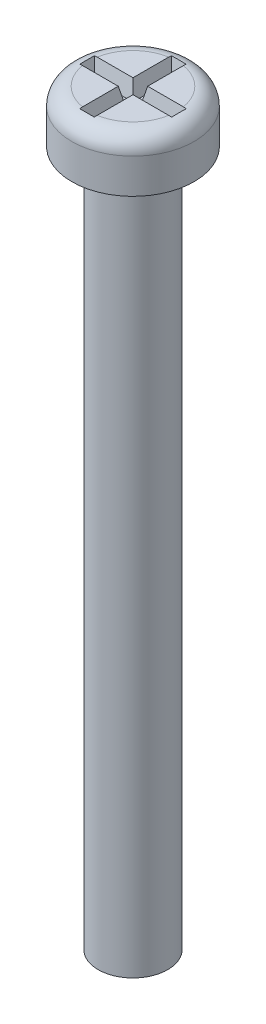
from build123d import *

# Parameters (mm, degrees)
SKETCH_1_R          = 2
EXTRUDE_1_DEPTH     = 40
SKETCH_2_R          = 3.515
EXTRUDE_2_DEPTH     = 3
CUT_EXTRUDE_1_DEPTH = 1
CUT_EXTRUDE_1_DRAFT = -12
FILLET_2_R          = 1


with BuildPart() as part:
    # Эскиз1 → Бобышка-Вытянуть1 (new body)
    with BuildSketch(Plane(origin=(0, 0, 0), x_dir=(1, 0, 0), z_dir=(0, 1, 0))):
        with Locations(Location((0, 0, 0), (0, 0, 270))):
            Circle(SKETCH_1_R)
    extrude(amount=EXTRUDE_1_DEPTH)

    # Эскиз2 → Бобышка-Вытянуть2 (add)
    with BuildSketch(Plane(origin=(0, 40, 0), x_dir=(1, 0, 0), z_dir=(0, 1, 0))):
        with Locations(Location((0, 0, 0), (0, 0, 270))):
            Circle(SKETCH_2_R)
    extrude(amount=EXTRUDE_2_DEPTH)


with BuildPart() as cut_extrude_1_tool:
    # Эскиз3 → Вырез-Вытянуть1 (with draft: the straight prism first)
    with BuildSketch(Plane(origin=(0, 43, 0), x_dir=(1, 0, 0), z_dir=(0, 1, 0))):
        Polygon((-2.641549473, 0.422769916), (-2.641549473, -0.422769916), (-0.422769916, -0.422769916), (-0.422769916, -2.641549473), (0.422769916, -2.641549473), (0.422769916, -0.422769916), (2.641549473, -0.422769916), (2.641549473, 0.422769916), (0.422769916, 0.422769916), (0.422769916, 2.641549473), (-0.422769916, 2.641549473), (-0.422769916, 0.422769916), align=None)
    extrude(amount=-CUT_EXTRUDE_1_DEPTH)
    # Вырез-Вытянуть1: the draft: its side faces are tilted about the plane it starts from
    cut_extrude_1_sides = [cut_extrude_1_tool.faces().sort_by_distance(p)[0] for p in [
        (-2.641549473, 42.5, 0),
        (-1.532159694, 42.5, 0.422769916),
        (-0.422769916, 42.5, 1.532159694),
        (0, 42.5, 2.641549473),
        (0.422769916, 42.5, 1.532159694),
        (1.532159694, 42.5, 0.422769916),
        (2.641549473, 42.5, 0),
        (1.532159694, 42.5, -0.422769916),
        (0.422769916, 42.5, -1.532159694),
        (0, 42.5, -2.641549473),
        (-0.422769916, 42.5, -1.532159694),
        (-1.532159694, 42.5, -0.422769916),
    ]]
    draft(cut_extrude_1_sides, Plane(origin=(0, 43, 0), x_dir=(1, 0, 0), z_dir=(0, 1, 0)), CUT_EXTRUDE_1_DRAFT)


with BuildPart() as part_1:
    add(part.part)

    # Вырез-Вытянуть1: cut by cut_extrude_1_tool
    add(cut_extrude_1_tool.part, mode=Mode.SUBTRACT)

    # Скругление2
    # the kernel refuses this fillet: 1 mm, written as the material it takes off along each edge
    with BuildSketch(Plane(origin=(0, 43, 0), x_dir=(0, 0, 1), z_dir=(-1, 0, 0))) as fillet_2_piece_1:
        with BuildLine():
            CenterArc((3.515 - FILLET_2_R, -FILLET_2_R), FILLET_2_R, 0, 90)
            Line((3.515 - FILLET_2_R, 0), (3.515, 0))
            Line((3.515, 0), (3.515, -FILLET_2_R))
        make_face()
    revolve(axis=Axis((0, 43, 0), (0, 1, 0)), mode=Mode.SUBTRACT)


solid = part_1.part
